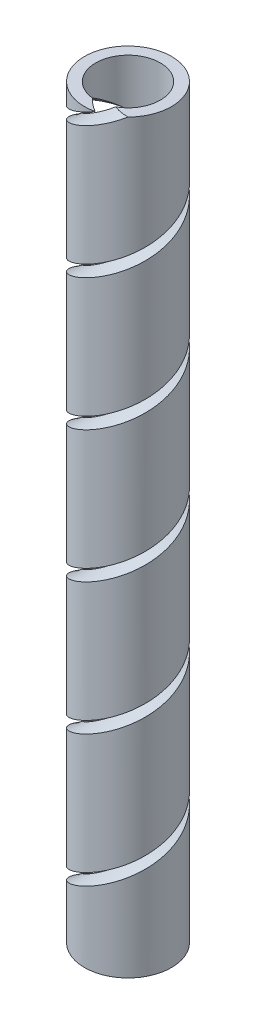
from build123d import *

# Parameters (mm, degrees)
SKETCH1_R           = 4.445
SKETCH1_R_2         = 3.302
BOSS_EXTRUDE1_DEPTH = 76.2
CUT_SWEEP1_PITCH    = 13.461


with BuildPart() as part:
    # Sketch1 → Boss-Extrude1 (new body)
    with BuildSketch(Plane(origin=(0, 0, 0), x_dir=(1, 0, 0), z_dir=(0, 1, 0))):
        with Locations(Location((0, 0, 0), (0, 0, 90))):
            Circle(SKETCH1_R)
        with Locations(Location((0, 0, 0), (0, 0, 90))):
            Circle(SKETCH1_R_2, mode=Mode.SUBTRACT)
    extrude(amount=BOSS_EXTRUDE1_DEPTH)

    # Cut-Sweep1: the profile of Sketch4 screwed along a right-hand helix of 5.75 turns, 18 arcs to a turn; built about Z, then put on its axis
    cut_sweep1_z = Axis((0, 0, 0), (0, 0, 1))
    cut_sweep1_corners = [(4.445, 0, 0), (2.308868132, 0.402682339, -0.835481604), (2.701117344, 0.794931551, -1.649316653), (4.837249212, 0.392249212, -0.813835049)]
    with BuildLine(mode=Mode.PRIVATE) as cut_sweep1_profile:
        Line(cut_sweep1_corners[0], cut_sweep1_corners[1])
        Line(cut_sweep1_corners[1], cut_sweep1_corners[2])
        Line(cut_sweep1_corners[2], cut_sweep1_corners[3])
        Line(cut_sweep1_corners[3], cut_sweep1_corners[0])
    cut_sweep1_cap = Face(cut_sweep1_profile.wire())
    cut_sweep1_turn_angles = [0, 10, 20, 30, 40, 50, 60, 70, 80, 90, 100, 110, 120, 130, 140, 150, 160, 170, 180, 190, 200, 210, 220, 230, 240, 250, 260, 270, 280, 290, 300, 310, 320, 330, 340, 350, 360]
    cut_sweep1_turn_weights = [1, 0.984807753012208, 1, 0.984807753012208, 1, 0.984807753012208, 1, 0.984807753012208, 1, 0.984807753012208, 1, 0.984807753012208, 1, 0.984807753012208, 1, 0.984807753012208, 1, 0.984807753012208, 1, 0.984807753012208, 1, 0.984807753012208, 1, 0.984807753012208, 1, 0.984807753012208, 1, 0.984807753012208, 1, 0.984807753012208, 1, 0.984807753012208, 1, 0.984807753012208, 1, 0.984807753012208, 1]
    cut_sweep1_turn_rails = [Edge.make_bspline([Vector(p[0], p[1], 0).rotate(cut_sweep1_z, cut_sweep1_turn_angles[k]) / cut_sweep1_turn_weights[k] + Vector(0, 0, p[2] + CUT_SWEEP1_PITCH * cut_sweep1_turn_angles[k] / 360) for k in range(37)], [0, 0, 0, 1, 1, 2, 2, 3, 3, 4, 4, 5, 5, 6, 6, 7, 7, 8, 8, 9, 9, 10, 10, 11, 11, 12, 12, 13, 13, 14, 14, 15, 15, 16, 16, 17, 17, 18, 18, 18], 2, cut_sweep1_turn_weights) for p in cut_sweep1_corners]
    cut_sweep1_turn_sides = [Face.make_surface_from_curves(cut_sweep1_turn_rails[p[0]], cut_sweep1_turn_rails[p[1]]) for p in [(0, 1), (1, 2), (2, 3), (3, 0)]]
    cut_sweep1_last_angles = [1800, 1810, 1820, 1830, 1840, 1850, 1860, 1870, 1880, 1890, 1900, 1910, 1920, 1930, 1940, 1950, 1960, 1970, 1980, 1990, 2000, 2010, 2020, 2030, 2040, 2050, 2060, 2065, 2070]
    cut_sweep1_last_weights = [1, 0.984807753012208, 1, 0.984807753012208, 1, 0.984807753012208, 1, 0.984807753012208, 1, 0.984807753012208, 1, 0.984807753012208, 1, 0.984807753012208, 1, 0.984807753012208, 1, 0.984807753012208, 1, 0.984807753012208, 1, 0.984807753012208, 1, 0.984807753012208, 1, 0.984807753012208, 1, 0.9961946980917438, 1]
    cut_sweep1_last_rails = [Edge.make_bspline([Vector(p[0], p[1], 0).rotate(cut_sweep1_z, cut_sweep1_last_angles[k]) / cut_sweep1_last_weights[k] + Vector(0, 0, p[2] + CUT_SWEEP1_PITCH * cut_sweep1_last_angles[k] / 360) for k in range(29)], [0, 0, 0, 1, 1, 2, 2, 3, 3, 4, 4, 5, 5, 6, 6, 7, 7, 8, 8, 9, 9, 10, 10, 11, 11, 12, 12, 13, 13, 14, 14, 14], 2, cut_sweep1_last_weights) for p in cut_sweep1_corners]
    cut_sweep1_last_sides = [Face.make_surface_from_curves(cut_sweep1_last_rails[p[0]], cut_sweep1_last_rails[p[1]]) for p in [(0, 1), (1, 2), (2, 3), (3, 0)]]
    cut_sweep1 = Plane(origin=(0, 76.2, 0), x_dir=(0.7071067811865488, 0, 0.7071067811865464), z_dir=(0, -1, 0)) * Solid(Shell([*[p.moved(Location((0, 0, CUT_SWEEP1_PITCH * i))) for i in range(5) for p in cut_sweep1_turn_sides], *cut_sweep1_last_sides, cut_sweep1_cap, cut_sweep1_cap.rotate(cut_sweep1_z, 2070).moved(Location((0, 0, CUT_SWEEP1_PITCH * 2070 / 360)))]))
    add(cut_sweep1, mode=Mode.SUBTRACT)


solid = part.part
